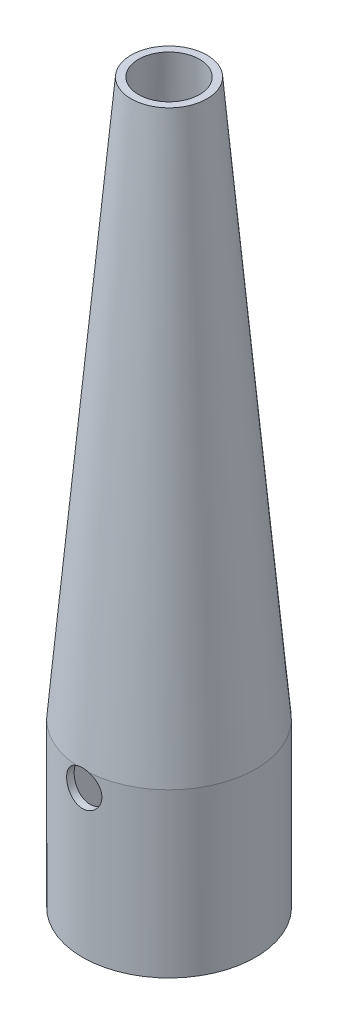
from build123d import *

# Parameters (mm, degrees)
SKETCH2_R          = 5.5
CUT_EXTRUDE1_DEPTH = 175.849713601


with BuildPart() as part:
    # Sketch1 → Revolve1 (revolve)
    with BuildSketch(Plane.XY):
        Polygon((11.819732149, 53.534936378), (9.525, 53.534936378), (24.692767851, -119.83344348), (24.692767851, -170.63344348), (26.9875, -170.63344348), (26.9875, -119.83344348), align=None)
    revolve(axis=Axis((0, 0, 0), (0, 1, 0)))

    # Sketch2 → Cut-Extrude1 (cut, through all)
    with BuildSketch(Plane.XY):
        with Locations((0, -124.965063622)):
            Circle(SKETCH2_R)
    extrude(amount=CUT_EXTRUDE1_DEPTH, mode=Mode.SUBTRACT)


solid = part.part
